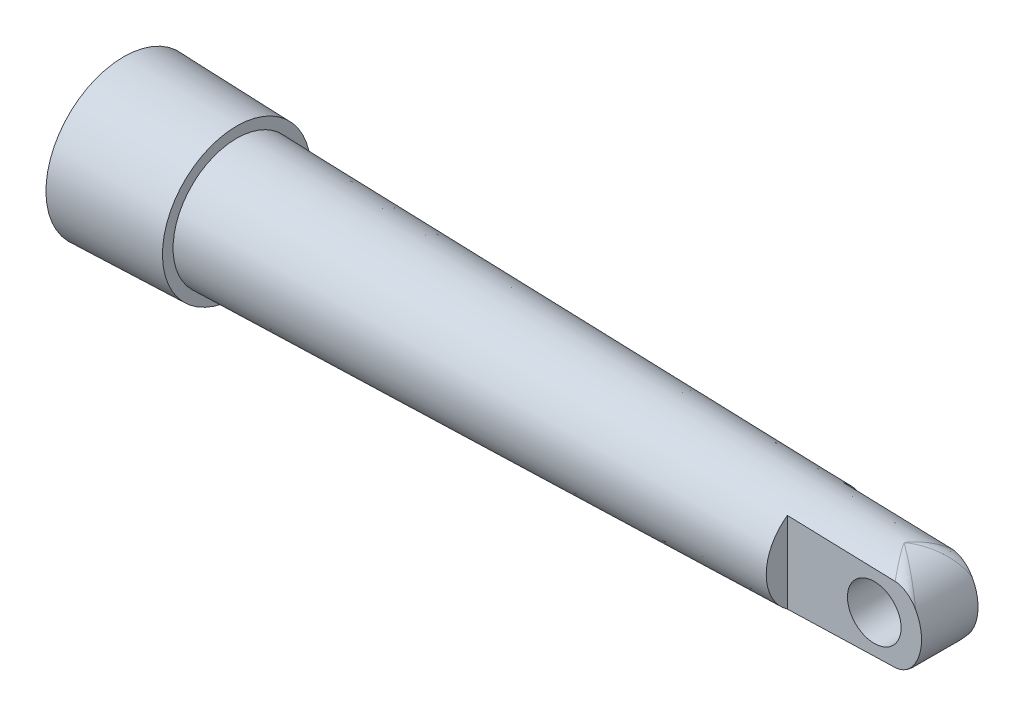
from build123d import *
from build123d.topology import SkipClean

# Parameters (mm, degrees)
BOSS_EXTRUDE1_DEPTH = 1
SKETCH5_R           = 0.95
CUT_EXTRUDE1_DEPTH  = 30.617351432
FILLET1_R           = 0.5
SKETCH6_R           = 1
CUT_EXTRUDE2_DEPTH  = 15


with BuildPart() as part:
    # Sketch1 → Revolve1 (revolve)
    with BuildSketch(Plane.XY):
        Polygon((0, 0), (0, 2.75), (4, 2.625), (4, 2.25), (24.5, 1.75), (24.5, 0), align=None)
    revolve(axis=Axis((24.5, 0, 0), (-1, 0, 0)))

    # Sketch2 → Boss-Extrude1 (add, symmetric)
    with BuildSketch(Plane.XY):
        with BuildLine():
            Line((24.5, 1.75), (27.575, 1.675))
            ThreePointArc((27.575, 1.675), (29.25, 0), (27.575, -1.675))
            Line((27.575, -1.675), (24.5, -1.75))
            Line((24.5, -1.75), (24.5, 1.75))
        make_face()
    extrude(amount=BOSS_EXTRUDE1_DEPTH, both=True)

    # Sketch4 → Cut-Revolve1 (revolve, cut)
    with SkipClean():  # the faces are left unmerged after this step: merging them gives an invalid solid
        with BuildSketch(Plane.XY):
            Polygon((24.5, 1.75), (24.5, 2.5), (31.380431179, 2.5), (31.386053793, 1.582047468), align=None)
        revolve(axis=Axis((24.5, 0, 0), (1, 0, 0)), mode=Mode.SUBTRACT)

    # Sketch5 → Cut-Extrude1 (cut, through all)
    with SkipClean():  # the faces are left unmerged after this step: merging them gives an invalid solid
        with BuildSketch(Plane.XY.offset(1)):
            with Locations((27.575, 0)):
                Circle(SKETCH5_R)
        extrude(amount=-CUT_EXTRUDE1_DEPTH, mode=Mode.SUBTRACT)

    # Fillet1
    fillet1_edges = [part.edges().sort_by_distance(p)[0] for p in [
        (27.656708431, -1.673007342, 8.787e-06),
        (28.140943444, 1.576493907, 0.523680014),
    ]]
    fillet(fillet1_edges, radius=FILLET1_R)

    # Sketch6 → Cut-Extrude2 (cut)
    with BuildSketch(Plane.ZY):
        Circle(SKETCH6_R)
    extrude(amount=-CUT_EXTRUDE2_DEPTH, mode=Mode.SUBTRACT)


solid = part.part
